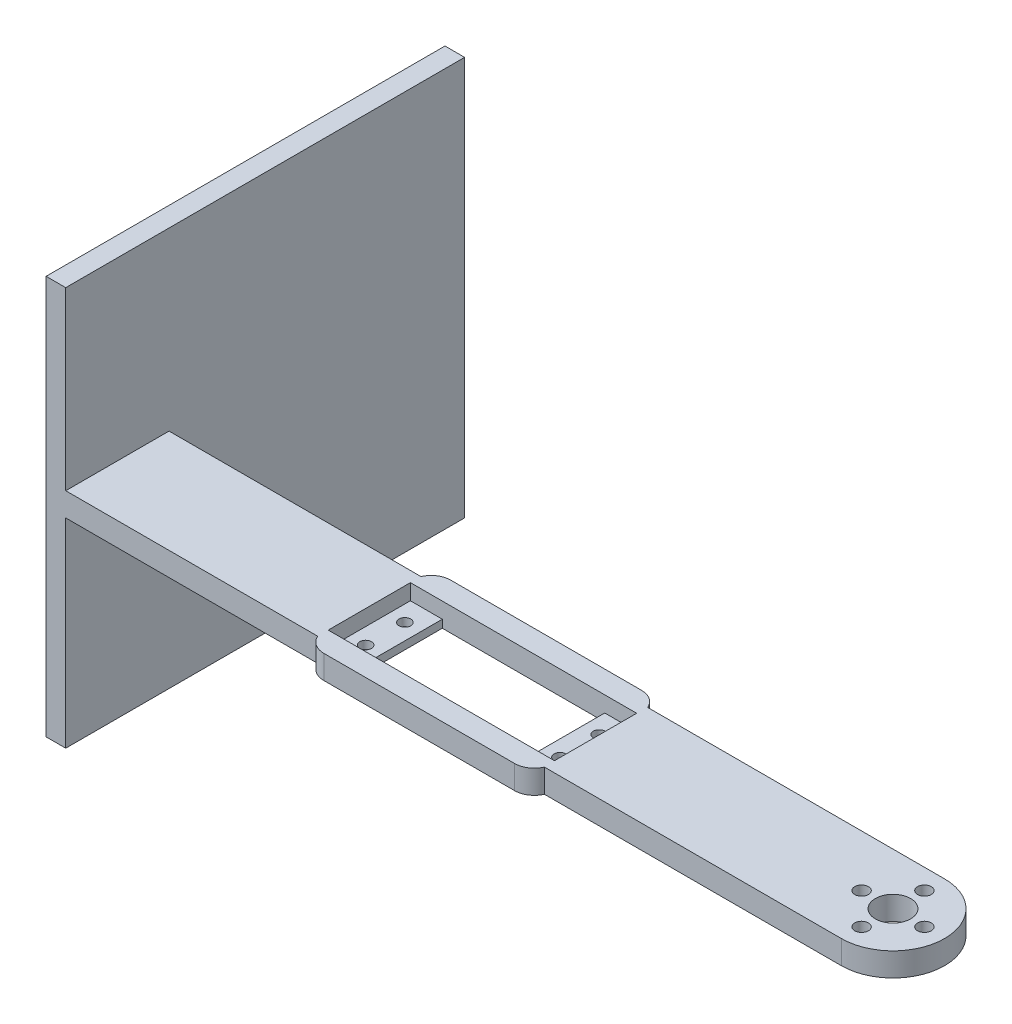
from build123d import *

# Parameters (mm, degrees)
SKETCH1_W                = 57.629592668
SKETCH1_H                = 21.211867522
SKETCH1_R                = 1.75
SKETCH1_R_2              = 4.5
BOSS_EXTRUDE1_DEPTH      = 6
SKETCH1_22_W             = 8.129592668
SKETCH1_22_H             = 21.211867522
SKETCH1_22_R             = 1.5
BOSS_EXTRUDE2_DEPTH      = 2
BOSS_EXTRUDE3_DEPTH      = 50.8
BOSS_EXTRUDE3_DEPTH_BACK = 50.8
SKETCH1_23_W             = 5
SKETCH1_23_H             = 75.291254256
SKETCH1_23_H_2           = 26.308745744
SKETCH4_W                = 57.748953374
SKETCH4_H                = 6
BOSS_EXTRUDE4_DEPTH      = 3
FILLET2_R                = 5
FILLET2_OF_MIRROR1_R     = 5


with BuildPart() as part:
    # Sketch1 → Boss-Extrude1 (new body)
    with BuildSketch(Plane(origin=(0, 0, 0), x_dir=(1, 0, 0), z_dir=(0, 1, 0))):
        with BuildLine():
            Line((-197.556308439, -13.154372872), (0, -13.154372872))
            ThreePointArc((0, -13.154372872), (13.154372872, 0), (0, 13.154372872))
            Line((0, 13.154372872), (-197.556308439, 13.154372872))
            Line((-197.556308439, 13.154372872), (-197.556308439, -13.154372872))
        make_face()
        with Locations((-104.57172107, -0.139435446)):
            Rectangle(SKETCH1_W, SKETCH1_H, mode=Mode.SUBTRACT)
        with Locations(Location((0, 8, 0), (0, 0, 270))):
            Circle(SKETCH1_R, mode=Mode.SUBTRACT)
        with Locations(Location((0, -8, 0), (0, 0, 270))):
            Circle(SKETCH1_R, mode=Mode.SUBTRACT)
        with Locations(Location((-8, 0, 0), (0, 0, 270))):
            Circle(SKETCH1_R, mode=Mode.SUBTRACT)
        with Locations(Location((0, 0, 0), (0, 0, 270))):
            Circle(SKETCH1_R_2, mode=Mode.SUBTRACT)
        with Locations(Location((8, 0, 0), (0, 0, 270))):
            Circle(SKETCH1_R, mode=Mode.SUBTRACT)
    boss_extrude1 = extrude(amount=BOSS_EXTRUDE1_DEPTH)

    # Sketch1<22> → Boss-Extrude2 (add)
    # profile 1 of 2: a face of its own
    with BuildSketch(Plane(origin=(0, 0, 0), x_dir=(1, 0, 0), z_dir=(0, 1, 0))):
        with Locations((-129.32172107, -0.139435446)):
            Rectangle(SKETCH1_22_W, SKETCH1_22_H)
        with Locations(Location((-129.32172107, -5, 0), (0, 0, 270))):
            Circle(SKETCH1_22_R, mode=Mode.SUBTRACT)
        with Locations(Location((-129.32172107, 5, 0), (0, 0, 270))):
            Circle(SKETCH1_22_R, mode=Mode.SUBTRACT)
    # profile 2 of 2: a face of its own
    with BuildSketch(Plane(origin=(0, 0, 0), x_dir=(1, 0, 0), z_dir=(0, 1, 0))):
        with Locations((-79.82172107, -0.139435446)):
            Rectangle(SKETCH1_22_W, SKETCH1_22_H)
        with Locations(Location((-79.82172107, -5, 0), (0, 0, 270))):
            Circle(SKETCH1_22_R, mode=Mode.SUBTRACT)
        with Locations(Location((-79.82172107, 5, 0), (0, 0, 270))):
            Circle(SKETCH1_22_R, mode=Mode.SUBTRACT)
    extrude(amount=BOSS_EXTRUDE2_DEPTH)

    # Sketch1<23> → Boss-Extrude3 (add, two sides: drawn at the far end of the back side and taken through both)
    with BuildSketch(Plane(origin=(0, 0, 0), x_dir=(1, 0, 0), z_dir=(0, 1, 0)).offset(-BOSS_EXTRUDE3_DEPTH_BACK)):
        with Locations((-200.056308439, 50.8)):
            Rectangle(SKETCH1_23_W, SKETCH1_23_H)
        with Locations((-200.056308439, 0)):
            Rectangle(SKETCH1_23_W, SKETCH1_23_H_2)
    extrude(amount=BOSS_EXTRUDE3_DEPTH + BOSS_EXTRUDE3_DEPTH_BACK)

    # Sketch4 → Boss-Extrude4 (add)
    with BuildSketch(Plane.XY.offset(13.154372872)):
        with Locations((-104.509525291, 3)):
            Rectangle(SKETCH4_W, SKETCH4_H)
    boss_extrude4 = extrude(amount=BOSS_EXTRUDE4_DEPTH)

    # Fillet2
    # the kernel refuses this fillet: 5 mm, written as the material it takes off along each edge
    with BuildSketch(Plane(origin=(-75.635048604, -11.456439237, 16.154372872), x_dir=(-1, 0, 0), z_dir=(0, 1, 0))) as fillet2_piece_1:
        with BuildLine():
            CenterArc((4.582575695, -5), FILLET2_R, 90, 66.421821522)
            Line((0, -3), (-0.091651514, -2.96))
            ThreePointArc((-0.091651514, -2.96), (-0.1, -1.5), (-0.1, 0))
            Line((-0.1, 0), (0, 0.1))
            Line((0, 0.1), (4.582575695, 0.1))
            Line((4.582575695, 0.1), (4.582575695, 0))
        make_face()
    extrude(amount=28.912878475, mode=Mode.SUBTRACT)
    with BuildSketch(Plane(origin=(-133.384001978, 17.456439237, 16.154372872), x_dir=(0, 0, -1), z_dir=(0, -1, 0))) as fillet2_piece_2:
        with BuildLine():
            CenterArc((5, 4.582575695), FILLET2_R, 180, 66.421821522)
            Line((0, 4.582575695), (-0.1, 4.582575695))
            Line((-0.1, 4.582575695), (-0.1, 0))
            Line((-0.1, 0), (0, -0.1))
            ThreePointArc((0, -0.1), (1.5, -0.1), (2.96, -0.091651514))
            Line((2.96, -0.091651514), (3, 0))
        make_face()
    extrude(amount=28.912878475, mode=Mode.SUBTRACT)

    # Mirror1: Boss-Extrude1, Boss-Extrude4 across plane
    add(boss_extrude1.mirror(Plane(origin=(0, 0, 0), x_dir=(1, 0, 0), z_dir=(0, 0, -1))))
    add(boss_extrude4.mirror(Plane(origin=(0, 0, 0), x_dir=(1, 0, 0), z_dir=(0, 0, -1))))

    # Fillet2 of Mirror1
    # the kernel refuses this fillet: 5 mm, written as the material it takes off along each edge
    with BuildSketch(Plane(origin=(-75.635048604, -11.456439237, -16.154372872), x_dir=(0, 0, 1), z_dir=(0, 1, 0)), Plane(origin=(-133.384001978, 17.456439237, -16.154372872), x_dir=(0, 0, 1), z_dir=(0, -1, 0))) as fillet2_of_mirror1_piece_1:
        with BuildLine():
            CenterArc((5, -4.582575695), FILLET2_OF_MIRROR1_R, 113.578178478, 66.421821522)
            Line((0, -4.582575695), (-0.1, -4.582575695))
            Line((-0.1, -4.582575695), (-0.1, 0))
            Line((-0.1, 0), (0, 0.1))
            ThreePointArc((0, 0.1), (1.5, 0.1), (2.96, 0.091651514))
            Line((2.96, 0.091651514), (3, 0))
        make_face()
    extrude(amount=28.912878475, mode=Mode.SUBTRACT)


solid = part.part
